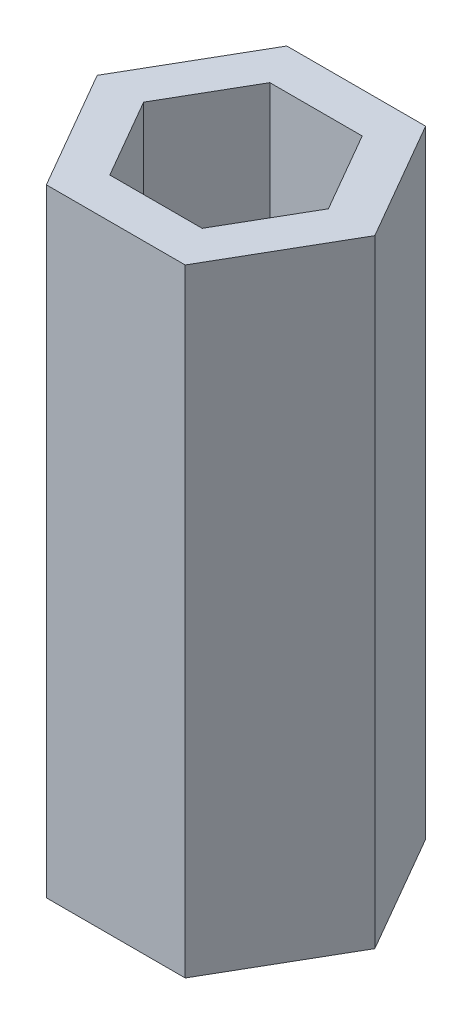
from build123d import *

# Parameters (mm, degrees)
BOSS_EXTRUDE1_DEPTH = 27.397749878


with BuildPart() as part:
    # Sketch1 → Boss-Extrude1 (new body)
    with BuildSketch(Plane(origin=(0, 0, 0), x_dir=(1, 0, 0), z_dir=(0, 1, 0))):
        Polygon((6.159172672, 0), (3.079586336, 5.334), (-3.079586336, 5.334), (-6.159172672, 0), (-3.079586336, -5.334), (3.079586336, -5.334), align=None)
        Polygon((4.098782766, 0), (2.049391383, 3.54965), (-2.049391383, 3.54965), (-4.098782766, 0), (-2.049391383, -3.54965), (2.049391383, -3.54965), align=None, mode=Mode.SUBTRACT)
    extrude(amount=BOSS_EXTRUDE1_DEPTH)


solid = part.part
